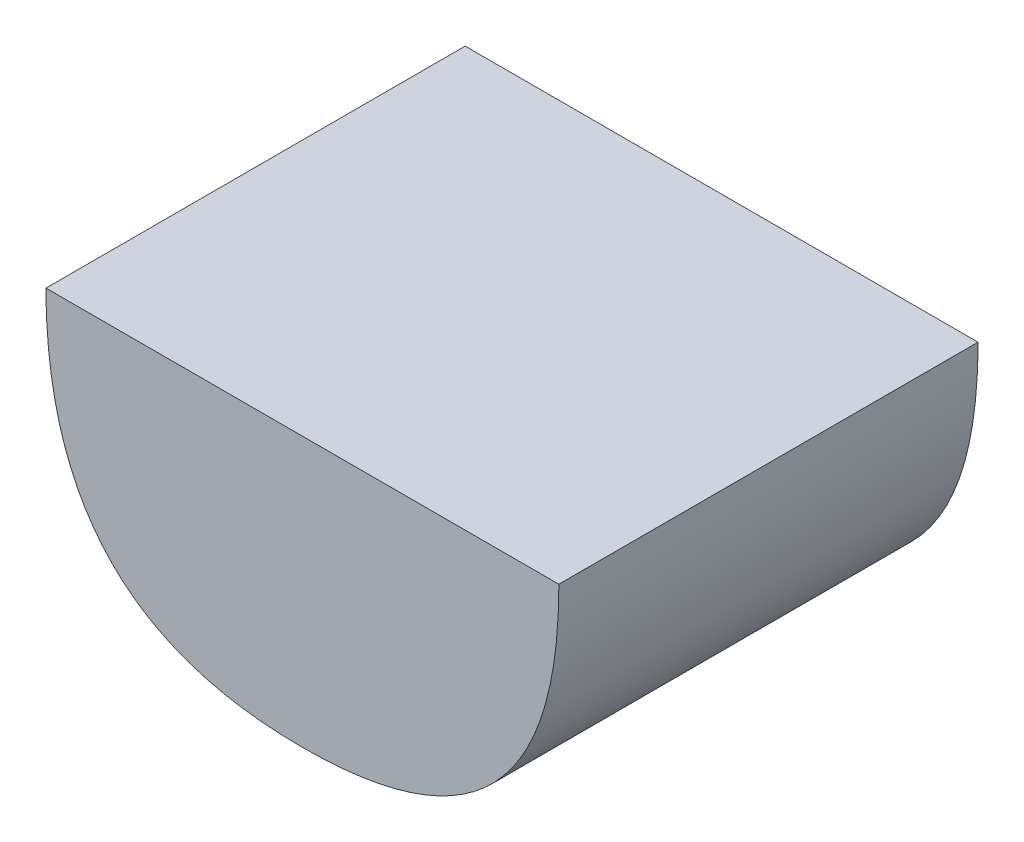
from build123d import *

# Parameters (mm, degrees)
BOSS_EXTRUDE1_DEPTH      = 247.142
BOSS_EXTRUDE1_DEPTH_BACK = 247.142


with BuildPart() as part:
    # Sketch1 → Boss-Extrude1 (new, two sides: drawn at the far end of the back side and taken through both)
    with BuildSketch(Plane.XY.offset(-BOSS_EXTRUDE1_DEPTH_BACK)):
        with BuildLine():
            Line((-302.357037841, 317.813001305), (302.357037841, 317.813001305))
            add(Edge.make_bspline(
                [(0, 0), (302.357037841, -0.066445002), (302.357037841, 317.813001305)],
                knots=[0, 0, 0, 1, 1, 1], degree=2, weights=[1, 1.019369595, 1]))
            add(Edge.make_bspline(
                [(0, 0), (-302.357037841, -0.066445002), (-302.357037841, 317.813001305)],
                knots=[0, 0, 0, 1, 1, 1], degree=2, weights=[1, 1.019369595, 1]))
        make_face()
    extrude(amount=BOSS_EXTRUDE1_DEPTH + BOSS_EXTRUDE1_DEPTH_BACK)


solid = part.part
